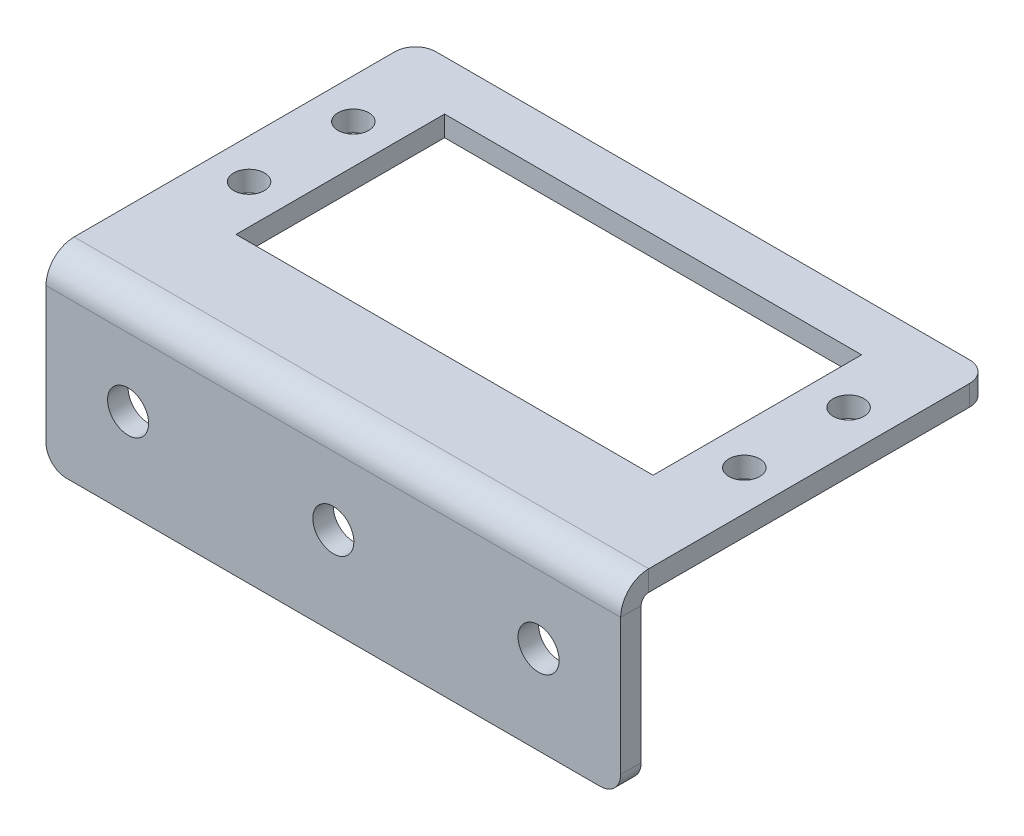
from build123d import *

# Parameters (mm, degrees)
SKETCH1_W                    = 56
SKETCH1_H                    = 34
BASE_FLANGE1_DEPTH           = 2
EDGE_FLANGE1_STRIP_W         = 9.4732
EDGE_FLANGE1_STRIP_H         = 2
EDGE_FLANGE1_STRIP_CUT_DEPTH = 56
EDGE_FLANGE1_DEPTH           = 56
SKETCH9_W                    = 40.64
SKETCH9_H                    = 20.32
CUT_EXTRUDE1_DEPTH           = 39.327535793
SKETCH10_R                   = 1.5
CUT_EXTRUDE2_DEPTH           = 39.327535793
FILLET1_R                    = 2
SKETCH11_R                   = 2
CUT_EXTRUDE3_DEPTH           = 48.581509013


# Sheet-metal steps are written as plain solids
with BuildPart() as part:
    # Sketch1 → Base-Flange1 (new body)
    with BuildSketch(Plane(origin=(0, 0, 0), x_dir=(1, 0, 0), z_dir=(0, 1, 0))):
        Rectangle(SKETCH1_W, SKETCH1_H)
    extrude(amount=-BASE_FLANGE1_DEPTH)

    # Edge-Flange1 strip (across the edge) → Edge-Flange1 strip cut (cut)
    with BuildSketch(Plane(origin=(28, -2, 17), x_dir=(0, 0, -1), z_dir=(-1, 0, 0))):
        with Locations((-4, -1)):
            Rectangle(EDGE_FLANGE1_STRIP_W, EDGE_FLANGE1_STRIP_H)
    extrude(amount=EDGE_FLANGE1_STRIP_CUT_DEPTH, mode=Mode.SUBTRACT)

    # Edge-Flange1 section (across the edge) → Edge-Flange1 (add)
    with BuildSketch(Plane(origin=(28, -2, 17), x_dir=(0, 0, -1), z_dir=(-1, 0, 0))):
        with BuildLine():
            Line((-2, 0.7366), (-2, 16))
            Line((-2, 16), (0, 16))
            Line((0, 16), (0, 0.7366))
            ThreePointArc((0, 0.7366), (0.215745145, 0.215745145), (0.7366, 0))
            Line((0.7366, 0), (0.7366, -2))
            ThreePointArc((0.7366, -2), (-1.198468417, -1.198468417), (-2, 0.7366))
        make_face()
    extrude(amount=EDGE_FLANGE1_DEPTH)

    # Sketch9 → Cut-Extrude1 (cut, through all)
    with BuildSketch(Plane(origin=(0, 0, 0), x_dir=(1, 0, 0), z_dir=(0, 1, 0))):
        with Locations((0, 2)):
            Rectangle(SKETCH9_W, SKETCH9_H)
    extrude(amount=-CUT_EXTRUDE1_DEPTH, mode=Mode.SUBTRACT)

    # Sketch10 → Cut-Extrude2 (cut, through all)
    with BuildSketch(Plane(origin=(0, 0, 0), x_dir=(1, 0, 0), z_dir=(0, 1, 0))):
        with Locations(Location((-24.13, 7.08, 0), (0, 0, 270))):
            Circle(SKETCH10_R)
        with Locations(Location((-24.13, -3.08, 0), (0, 0, 270))):
            Circle(SKETCH10_R)
        with Locations(Location((24.13, 7.08, 0), (0, 0, 270))):
            Circle(SKETCH10_R)
        with Locations(Location((24.13, -3.08, 0), (0, 0, 270))):
            Circle(SKETCH10_R)
    extrude(amount=-CUT_EXTRUDE2_DEPTH, mode=Mode.SUBTRACT)

    # Fillet1
    fillet1_edges = [part.edges().sort_by_distance(p)[0] for p in [
        (28, -18, 18),
        (-28, -18, 18),
        (-28, -1, -17),
        (28, -1, -17),
    ]]
    fillet(fillet1_edges, radius=FILLET1_R)

    # Sketch11 → Cut-Extrude3 (cut, through all)
    with BuildSketch(Plane(origin=(0, 0, 17), x_dir=(-1, 0, 0), z_dir=(0, 0, -1))):
        with Locations(Location((0, -9.3683, 0), (0, 0, 90))):
            Circle(SKETCH11_R)
        with Locations(Location((-20, -9.3683, 0), (0, 0, 90))):
            Circle(SKETCH11_R)
        with Locations(Location((20, -9.3683, 0), (0, 0, 90))):
            Circle(SKETCH11_R)
    extrude(amount=-CUT_EXTRUDE3_DEPTH, mode=Mode.SUBTRACT)


solid = part.part
